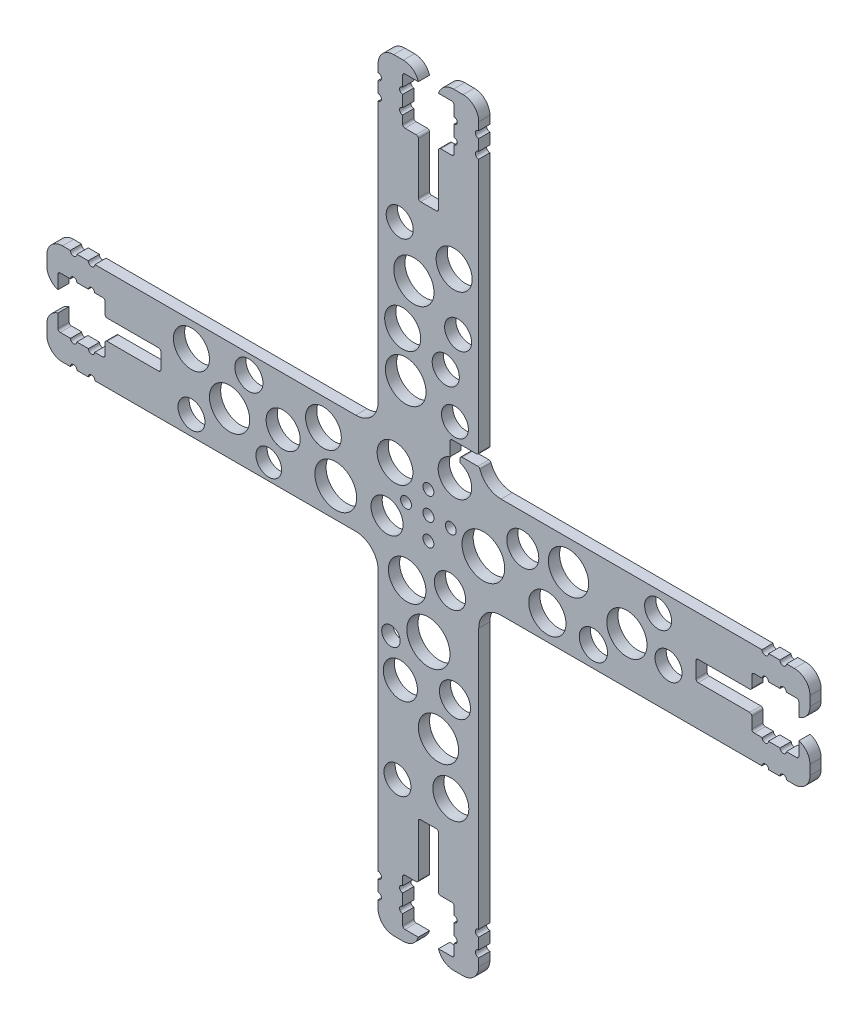
from build123d import *

# Parameters (mm, degrees)
ESQUISSE1_R             = 2.5
ESQUISSE1_R_2           = 6.290378139
ESQUISSE1_R_3           = 7.618744883
ESQUISSE1_R_4           = 9.342884094
ESQUISSE1_R_5           = 8
ESQUISSE1_R_6           = 5.733985396
ESQUISSE1_R_7           = 7.168610424
ESQUISSE1_R_8           = 9.550978203
ESQUISSE1_R_9           = 7.5
ESQUISSE1_R_10          = 9.082726935
ESQUISSE1_R_11          = 6
ESQUISSE1_R_12          = 7.167750482
ESQUISSE1_R_13          = 9.647142891
ESQUISSE1_R_14          = 4.114545692
ESQUISSE1_R_15          = 6.948511996
ESQUISSE1_R_16          = 7.63639155
ESQUISSE1_R_17          = 6.963077324
ESQUISSE1_R_18          = 8.386224211
ESQUISSE1_R_19          = 8.327924915
ESQUISSE1_R_20          = 9
ESQUISSE1_R_21          = 6.032963566
ESQUISSE1_R_22          = 8.061490044
ESQUISSE1_R_23          = 6.061600086
ESQUISSE1_R_24          = 6.327570879
ESQUISSE1_R_25          = 2.440410915
BOSS_EXTRU_1_DEPTH      = 5
CONG_1_R                = 7
CONG_2_R                = 10
CONG_3_R                = 1
ENL_V_MAT_EXTRU_1_DEPTH = 5
ENL_V_MAT_EXTRU_2_DEPTH = 10
CONG_4_R                = 1


with BuildPart() as part:
    # Esquisse1 → Boss.-Extru.1 (new body)
    with BuildSketch(Plane.XY):
        Polygon((-22.5, 22.5), (-22.5, 170.634559673), (-4.5, 170.634559673), (-4.5, 165.634559673), (-11.5, 165.634559673), (-11.5, 144.634559673), (-4.5, 144.634559673), (-4.5, 119.634559673), (4.5, 119.634559673), (4.5, 144.634559673), (11.5, 144.634559673), (11.5, 165.634559673), (4.5, 165.634559673), (4.5, 170.634559673), (22.5, 170.634559673), (22.5, 22.5), (170.634559673, 22.5), (170.634559673, 4.5), (165.634559673, 4.5), (165.634559673, 11.5), (144.634559673, 11.5), (144.634559673, 4.5), (119.634559673, 4.5), (119.634559673, -4.5), (144.634559673, -4.5), (144.634559673, -11.5), (165.634559673, -11.5), (165.634559673, -4.5), (170.634559673, -4.5), (170.634559673, -22.5), (22.5, -22.5), (22.5, -170.634559673), (4.5, -170.634559673), (4.5, -165.634559673), (11.5, -165.634559673), (11.5, -144.634559673), (4.5, -144.634559673), (4.5, -119.634559673), (-4.5, -119.634559673), (-4.5, -144.634559673), (-11.5, -144.634559673), (-11.5, -165.634559673), (-4.5, -165.634559673), (-4.5, -170.634559673), (-22.5, -170.634559673), (-22.5, -22.5), (-170.634559673, -22.5), (-170.634559673, -4.5), (-165.634559673, -4.5), (-165.634559673, -11.5), (-144.634559673, -11.5), (-144.634559673, -4.5), (-119.634559673, -4.5), (-119.634559673, 4.5), (-144.634559673, 4.5), (-144.634559673, 11.5), (-165.634559673, 11.5), (-165.634559673, 4.5), (-170.634559673, 4.5), (-170.634559673, 22.5), align=None)
        Circle(ESQUISSE1_R, mode=Mode.SUBTRACT)
        with Locations((-80.282411018, 14.110251439)):
            Circle(ESQUISSE1_R_2, mode=Mode.SUBTRACT)
        with Locations((-64.949362121, 0.629584275)):
            Circle(ESQUISSE1_R_3, mode=Mode.SUBTRACT)
        with Locations((-41.430541152, -9.342884094)):
            Circle(ESQUISSE1_R_4, mode=Mode.SUBTRACT)
        with Locations((-46.944423754, 10.513709378)):
            Circle(ESQUISSE1_R_5, mode=Mode.SUBTRACT)
        with Locations((-71.395066993, -15.225367939)):
            Circle(ESQUISSE1_R_6, mode=Mode.SUBTRACT)
        with Locations((42.187874431, 8.059360788)):
            Circle(ESQUISSE1_R_7, mode=Mode.SUBTRACT)
        with Locations((24.569766698, -3.608898698)):
            Circle(ESQUISSE1_R_8, mode=Mode.SUBTRACT)
        with Locations((11.862667495, 20.250700486)):
            Circle(ESQUISSE1_R_9, mode=Mode.SUBTRACT)
        with Locations((-14.944104017, 12.98285728)):
            Circle(ESQUISSE1_R_5, mode=Mode.SUBTRACT)
        with Locations((-10.143293911, 47.063988669)):
            Circle(ESQUISSE1_R_10, mode=Mode.SUBTRACT)
        with Locations((11.862667495, 42.14894077)):
            Circle(ESQUISSE1_R_11, mode=Mode.SUBTRACT)
        with Locations((-18.5, -9.342884094)):
            Circle(ESQUISSE1_R_12, mode=Mode.SUBTRACT)
        with Locations((0, -49.063569244)):
            Circle(ESQUISSE1_R_13, mode=Mode.SUBTRACT)
        with Locations((-16.764691508, -55.059756167)):
            Circle(ESQUISSE1_R_14, mode=Mode.SUBTRACT)
        with Locations((11.862667495, -65.512685953)):
            Circle(ESQUISSE1_R_15, mode=Mode.SUBTRACT)
        with Locations((-12.542488913, -70.059759302)):
            Circle(ESQUISSE1_R_16, mode=Mode.SUBTRACT)
        with Locations((9.647142891, -24.376295094)):
            Circle(ESQUISSE1_R_17, mode=Mode.SUBTRACT)
        with Locations((-9.504865065, -29.928488599)):
            Circle(ESQUISSE1_R_18, mode=Mode.SUBTRACT)
        with Locations((53.183428634, -11.306432287)):
            Circle(ESQUISSE1_R_19, mode=Mode.SUBTRACT)
        with Locations((62.644662275, 9.24529367)):
            Circle(ESQUISSE1_R_20, mode=Mode.SUBTRACT)
        with Locations((13.271791627, 76.57620739)):
            Circle(ESQUISSE1_R_21, mode=Mode.SUBTRACT)
        with Locations((-11.5, 66.604890937)):
            Circle(ESQUISSE1_R_22, mode=Mode.SUBTRACT)
        with Locations((7.759849222, 60.302853622)):
            Circle(ESQUISSE1_R_23, mode=Mode.SUBTRACT)
        with Locations((73.769463808, -13.24450165)):
            Circle(ESQUISSE1_R_24, mode=Mode.SUBTRACT)
        with Locations((10, 0)):
            Circle(ESQUISSE1_R_25, mode=Mode.SUBTRACT)
        with Locations((0, -10)):
            Circle(ESQUISSE1_R_25, mode=Mode.SUBTRACT)
        with Locations((-10, 0)):
            Circle(ESQUISSE1_R_25, mode=Mode.SUBTRACT)
        with Locations((0, 10)):
            Circle(ESQUISSE1_R_25, mode=Mode.SUBTRACT)
        with Locations((4.5, -84.339638888)):
            Circle(ESQUISSE1_R_20, mode=Mode.SUBTRACT)
        with Locations((88.750813809, -1.44975835)):
            Circle(ESQUISSE1_R_20, mode=Mode.SUBTRACT)
        with Locations((-88.909830144, -3.107555961)):
            Circle(ESQUISSE1_R_20, mode=Mode.SUBTRACT)
        with Locations((-6.491462568, 87.5045149)):
            Circle(ESQUISSE1_R_20, mode=Mode.SUBTRACT)
        with Locations((102.70743794, 13.340261639)):
            Circle(ESQUISSE1_R_21, mode=Mode.SUBTRACT)
        with Locations((107.372632302, -4.5)):
            Circle(ESQUISSE1_R_21, mode=Mode.SUBTRACT)
        with Locations((-13.833364179, -109.215120407)):
            Circle(ESQUISSE1_R_21, mode=Mode.SUBTRACT)
        with Locations((-105.951046037, -13.939551994)):
            Circle(ESQUISSE1_R_21, mode=Mode.SUBTRACT)
        with Locations((-12.841138419, 107.170672069)):
            Circle(ESQUISSE1_R_21, mode=Mode.SUBTRACT)
        with Locations((11.5, 101.069212607)):
            Circle(ESQUISSE1_R_22, mode=Mode.SUBTRACT)
        with Locations((10, -104.740308927)):
            Circle(ESQUISSE1_R_22, mode=Mode.SUBTRACT)
        with Locations((-105.951046037, 11.5)):
            Circle(ESQUISSE1_R_22, mode=Mode.SUBTRACT)
    extrude(amount=BOSS_EXTRU_1_DEPTH)

    # Congé1
    # the kernel refuses this fillet: 7 mm, written as the material it takes off along each edge
    with BuildSketch(Plane(origin=(170.634559673, 4.5, -16.770509831), x_dir=(0, 1, 0), z_dir=(0, 0, 1)), Plane(origin=(4.5, -170.634559673, -16.770509831), x_dir=(1, 0, 0), z_dir=(0, 0, 1)), Plane(origin=(-170.634559673, -4.5, -16.770509831), x_dir=(0, -1, 0), z_dir=(0, 0, 1)), Plane(origin=(-4.5, 170.634559673, -16.770509831), x_dir=(-1, 0, 0), z_dir=(0, 0, 1))) as cong_1_piece_1:
        with BuildLine():
            CenterArc((6.708203932, 7), CONG_1_R, 196.601549599, 73.398450401)
            Line((0, 5), (-0.134164079, 4.96))
            ThreePointArc((-0.134164079, 4.96), (-0.14, 2.5), (-0.14, 0))
            Line((-0.14, 0), (0, -0.14))
            Line((0, -0.14), (6.708203932, -0.14))
            Line((6.708203932, -0.14), (6.708203932, 0))
        make_face()
    extrude(amount=38.541019662, mode=Mode.SUBTRACT)
    with BuildSketch(Plane(origin=(170.634559673, -4.5, -16.770509831), x_dir=(-1, 0, 0), z_dir=(0, 0, 1)), Plane(origin=(-4.5, -170.634559673, -16.770509831), x_dir=(0, 1, 0), z_dir=(0, 0, 1)), Plane(origin=(-170.634559673, 4.5, -16.770509831), x_dir=(1, 0, 0), z_dir=(0, 0, 1)), Plane(origin=(4.5, 170.634559673, -16.770509831), x_dir=(0, -1, 0), z_dir=(0, 0, 1))) as cong_1_piece_2:
        with BuildLine():
            CenterArc((7, 6.708203932), CONG_1_R, 180, 73.398450401)
            Line((0, 6.708203932), (-0.14, 6.708203932))
            Line((-0.14, 6.708203932), (-0.14, 0))
            Line((-0.14, 0), (0, -0.14))
            ThreePointArc((0, -0.14), (2.5, -0.14), (4.96, -0.134164079))
            Line((4.96, -0.134164079), (5, 0))
        make_face()
    extrude(amount=38.541019662, mode=Mode.SUBTRACT)
    with BuildSketch(Plane(origin=(22.5, 170.634559673, -17.5), x_dir=(-1, 0, 0), z_dir=(0, 0, 1)), Plane(origin=(-22.5, 170.634559673, -17.5), x_dir=(0, -1, 0), z_dir=(0, 0, 1)), Plane(origin=(-170.634559673, 22.5, -17.5), x_dir=(0, -1, 0), z_dir=(0, 0, 1)), Plane(origin=(-170.634559673, -22.5, -17.5), x_dir=(1, 0, 0), z_dir=(0, 0, 1)), Plane(origin=(-22.5, -170.634559673, -17.5), x_dir=(1, 0, 0), z_dir=(0, 0, 1)), Plane(origin=(22.5, -170.634559673, -17.5), x_dir=(0, 1, 0), z_dir=(0, 0, 1)), Plane(origin=(170.634559673, -22.5, -17.5), x_dir=(0, 1, 0), z_dir=(0, 0, 1)), Plane(origin=(170.634559673, 22.5, -17.5), x_dir=(-1, 0, 0), z_dir=(0, 0, 1))) as cong_1_piece_3:
        with BuildLine():
            CenterArc((CONG_1_R, CONG_1_R), CONG_1_R, 180, 90)
            Line((0, CONG_1_R), (-CONG_1_R * 0.02, CONG_1_R))
            Line((-CONG_1_R * 0.02, CONG_1_R), (-CONG_1_R * 0.02, -CONG_1_R * 0.02))
            Line((-CONG_1_R * 0.02, -CONG_1_R * 0.02), (CONG_1_R, -CONG_1_R * 0.02))
            Line((CONG_1_R, -CONG_1_R * 0.02), (CONG_1_R, 0))
        make_face()
    extrude(amount=40, mode=Mode.SUBTRACT)

    # Congé2
    cong_2_edges = [part.edges().sort_by_distance(p)[0] for p in [
        (22.5, -22.5, 2.5),
        (-22.5, -22.5, 2.5),
        (-22.5, 22.5, 2.5),
        (22.5, 22.5, 2.5),
    ]]
    fillet(cong_2_edges, radius=CONG_2_R)

    # Congé3
    cong_3_edges = [part.edges().sort_by_distance(p)[0] for p in [
        (144.634559673, -11.5, 2.5),
        (165.634559673, -11.5, 2.5),
        (11.5, -165.634559673, 2.5),
        (11.5, -144.634559673, 2.5),
        (4.5, -144.634559673, 2.5),
        (4.5, -119.634559673, 2.5),
        (-4.5, -119.634559673, 2.5),
        (-4.5, -144.634559673, 2.5),
        (-11.5, -144.634559673, 2.5),
        (-11.5, -165.634559673, 2.5),
        (-165.634559673, -11.5, 2.5),
        (-144.634559673, -11.5, 2.5),
        (-144.634559673, -4.5, 2.5),
        (-119.634559673, -4.5, 2.5),
        (-119.634559673, 4.5, 2.5),
        (-144.634559673, 4.5, 2.5),
        (-144.634559673, 11.5, 2.5),
        (-165.634559673, 11.5, 2.5),
        (-11.5, 165.634559673, 2.5),
        (-11.5, 144.634559673, 2.5),
        (-4.5, 144.634559673, 2.5),
        (-4.5, 119.634559673, 2.5),
        (4.5, 119.634559673, 2.5),
        (4.5, 144.634559673, 2.5),
        (11.5, 144.634559673, 2.5),
        (11.5, 165.634559673, 2.5),
        (165.634559673, 11.5, 2.5),
        (144.634559673, 11.5, 2.5),
        (144.634559673, 4.5, 2.5),
        (119.634559673, 4.5, 2.5),
        (119.634559673, -4.5, 2.5),
        (144.634559673, -4.5, 2.5),
    ]]
    fillet(cong_3_edges, radius=CONG_3_R)

    # Esquisse2 → Enlèv. mat.-Extru.1 (cut)
    with BuildSketch(Plane(origin=(0, 0, 0), x_dir=(-1, 0, 0), z_dir=(0, 0, -1))):
        with BuildLine():
            Line((-160.134559673, 22.5), (-157.134559673, 22.5))
            ThreePointArc((-157.134559673, 22.5), (-158.634559673, 21), (-160.134559673, 22.5))
        make_face()
        with BuildLine():
            Line((-152.134559673, 22.5), (-149.134559673, 22.5))
            ThreePointArc((-149.134559673, 22.5), (-150.634559673, 21), (-152.134559673, 22.5))
        make_face()
        with BuildLine():
            Line((-160.134559673, -22.5), (-157.134559673, -22.5))
            ThreePointArc((-157.134559673, -22.5), (-158.634559673, -21), (-160.134559673, -22.5))
        make_face()
        with BuildLine():
            Line((-152.134559673, -22.5), (-149.134559673, -22.5))
            ThreePointArc((-149.134559673, -22.5), (-150.634559673, -21), (-152.134559673, -22.5))
        make_face()
        with BuildLine():
            Line((22.5, 160.134559673), (22.5, 157.134559673))
            ThreePointArc((22.5, 157.134559673), (21, 158.634559673), (22.5, 160.134559673))
        make_face()
        with BuildLine():
            Line((22.5, 152.134559673), (22.5, 149.134559673))
            ThreePointArc((22.5, 149.134559673), (21, 150.634559673), (22.5, 152.134559673))
        make_face()
        with BuildLine():
            Line((-22.5, 160.134559673), (-22.5, 157.134559673))
            ThreePointArc((-22.5, 157.134559673), (-21, 158.634559673), (-22.5, 160.134559673))
        make_face()
        with BuildLine():
            Line((-22.5, 152.134559673), (-22.5, 149.134559673))
            ThreePointArc((-22.5, 149.134559673), (-21, 150.634559673), (-22.5, 152.134559673))
        make_face()
        with BuildLine():
            Line((160.134559673, -22.5), (157.134559673, -22.5))
            ThreePointArc((157.134559673, -22.5), (158.634559673, -21), (160.134559673, -22.5))
        make_face()
        with BuildLine():
            Line((152.134559673, -22.5), (149.134559673, -22.5))
            ThreePointArc((149.134559673, -22.5), (150.634559673, -21), (152.134559673, -22.5))
        make_face()
        with BuildLine():
            Line((160.134559673, 22.5), (157.134559673, 22.5))
            ThreePointArc((157.134559673, 22.5), (158.634559673, 21), (160.134559673, 22.5))
        make_face()
        with BuildLine():
            Line((152.134559673, 22.5), (149.134559673, 22.5))
            ThreePointArc((149.134559673, 22.5), (150.634559673, 21), (152.134559673, 22.5))
        make_face()
        with BuildLine():
            Line((-22.5, -160.134559673), (-22.5, -157.134559673))
            ThreePointArc((-22.5, -157.134559673), (-21, -158.634559673), (-22.5, -160.134559673))
        make_face()
        with BuildLine():
            Line((-22.5, -152.134559673), (-22.5, -149.134559673))
            ThreePointArc((-22.5, -149.134559673), (-21, -150.634559673), (-22.5, -152.134559673))
        make_face()
        with BuildLine():
            Line((22.5, -160.134559673), (22.5, -157.134559673))
            ThreePointArc((22.5, -157.134559673), (21, -158.634559673), (22.5, -160.134559673))
        make_face()
        with BuildLine():
            Line((22.5, -152.134559673), (22.5, -149.134559673))
            ThreePointArc((22.5, -149.134559673), (21, -150.634559673), (22.5, -152.134559673))
        make_face()
        with BuildLine():
            Line((-157.234559673, 11.5), (-160.034559673, 11.5))
            ThreePointArc((-160.034559673, 11.5), (-158.634559673, 12.9), (-157.234559673, 11.5))
        make_face()
        with BuildLine():
            Line((-152.034559673, 11.5), (-149.234559673, 11.5))
            ThreePointArc((-149.234559673, 11.5), (-150.634559673, 12.9), (-152.034559673, 11.5))
        make_face()
        with BuildLine():
            Line((-152.034559673, -11.5), (-149.234559673, -11.5))
            ThreePointArc((-149.234559673, -11.5), (-150.634559673, -12.9), (-152.034559673, -11.5))
        make_face()
        with BuildLine():
            Line((-157.234559673, -11.5), (-160.034559673, -11.5))
            ThreePointArc((-160.034559673, -11.5), (-158.634559673, -12.9), (-157.234559673, -11.5))
        make_face()
        with BuildLine():
            Line((-11.5, 157.234559673), (-11.5, 160.034559673))
            ThreePointArc((-11.5, 160.034559673), (-12.9, 158.634559673), (-11.5, 157.234559673))
        make_face()
        with BuildLine():
            Line((-11.5, 152.034559673), (-11.5, 149.234559673))
            ThreePointArc((-11.5, 149.234559673), (-12.9, 150.634559673), (-11.5, 152.034559673))
        make_face()
        with BuildLine():
            Line((11.5, 157.234559673), (11.5, 160.034559673))
            ThreePointArc((11.5, 160.034559673), (12.9, 158.634559673), (11.5, 157.234559673))
        make_face()
        with BuildLine():
            Line((11.5, 152.034559673), (11.5, 149.234559673))
            ThreePointArc((11.5, 149.234559673), (12.9, 150.634559673), (11.5, 152.034559673))
        make_face()
        with BuildLine():
            Line((157.234559673, 11.5), (160.034559673, 11.5))
            ThreePointArc((160.034559673, 11.5), (158.634559673, 12.9), (157.234559673, 11.5))
        make_face()
        with BuildLine():
            Line((152.034559673, 11.5), (149.234559673, 11.5))
            ThreePointArc((149.234559673, 11.5), (150.634559673, 12.9), (152.034559673, 11.5))
        make_face()
        with BuildLine():
            Line((157.234559673, -11.5), (160.034559673, -11.5))
            ThreePointArc((160.034559673, -11.5), (158.634559673, -12.9), (157.234559673, -11.5))
        make_face()
        with BuildLine():
            Line((152.034559673, -11.5), (149.234559673, -11.5))
            ThreePointArc((149.234559673, -11.5), (150.634559673, -12.9), (152.034559673, -11.5))
        make_face()
        with BuildLine():
            Line((11.5, -157.234559673), (11.5, -160.034559673))
            ThreePointArc((11.5, -160.034559673), (12.9, -158.634559673), (11.5, -157.234559673))
        make_face()
        with BuildLine():
            Line((11.5, -152.034559673), (11.5, -149.234559673))
            ThreePointArc((11.5, -149.234559673), (12.9, -150.634559673), (11.5, -152.034559673))
        make_face()
        with BuildLine():
            Line((-11.5, -157.234559673), (-11.5, -160.034559673))
            ThreePointArc((-11.5, -160.034559673), (-12.9, -158.634559673), (-11.5, -157.234559673))
        make_face()
        with BuildLine():
            Line((-11.5, -152.034559673), (-11.5, -149.234559673))
            ThreePointArc((-11.5, -149.234559673), (-12.9, -150.634559673), (-11.5, -152.034559673))
        make_face()
    extrude(amount=-ENL_V_MAT_EXTRU_1_DEPTH, mode=Mode.SUBTRACT)

    # Esquisse3 → Enlèv. mat.-Extru.2 (cut)
    with BuildSketch(Plane(origin=(0, 0, 0), x_dir=(-1, 0, 0), z_dir=(0, 0, -1))):
        Polygon((-23.061872632, 34.510165549), (-9.612667495, 34.510165549), (-9.612667495, 27.405244496), (-14.112667495, 27.405244496), (-14.112667495, 30.010165549), (-23.061872632, 30.010165549), align=None)
    extrude(amount=-ENL_V_MAT_EXTRU_2_DEPTH, mode=Mode.SUBTRACT)

    # Congé4
    cong_4_edges = [part.edges().sort_by_distance(p)[0] for p in [
        (22.814922592, 30.010165549, 2.5),
        (22.5, 34.510165549, 2.5),
        (9.612667495, 34.510165549, 2.5),
        (14.112667495, 30.010165549, 2.5),
    ]]
    fillet(cong_4_edges, radius=CONG_4_R)


solid = part.part
